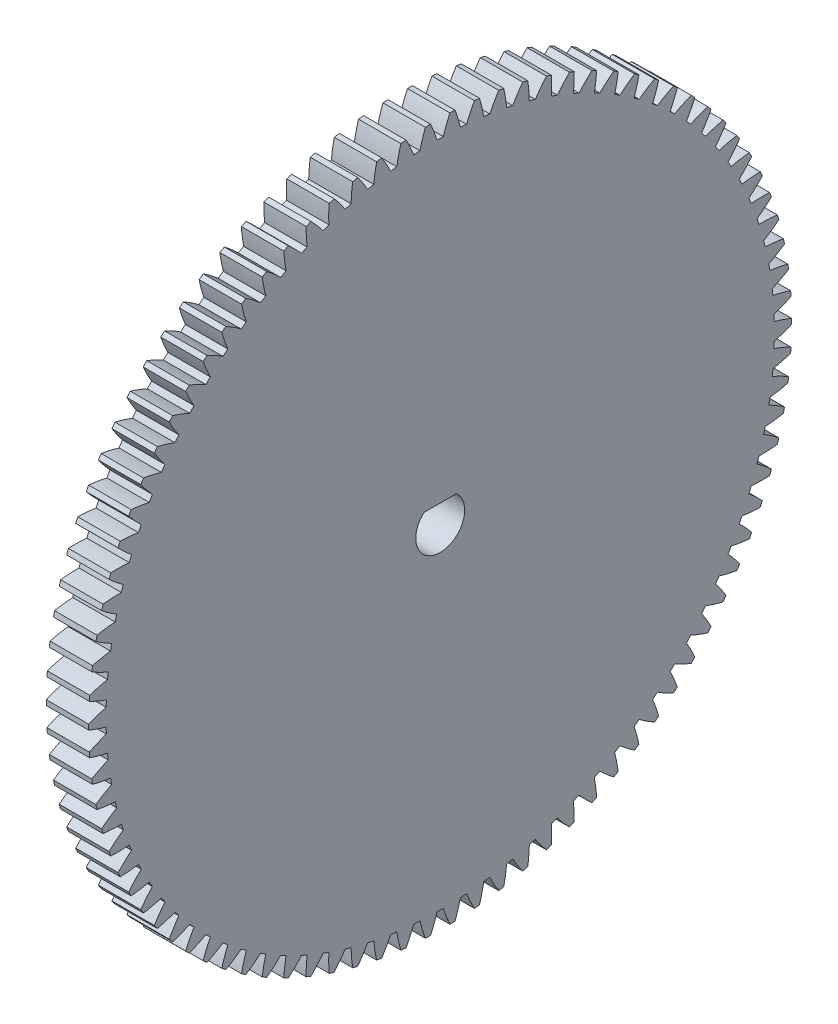
from build123d import *

# Parameters (mm, degrees)
BASPROSKE_W     = 4.4069
BASPROSKE_H     = 36.5125
TOOTHCUT_DEPTH  = 52.824184317
TEETHCUTS_COUNT = 90
TEETHCUTS_ANGLE = 356
BORE_DEPTH      = 50.8000508


with BuildPart() as part:
    # BasProSke → Base-Revolve (revolve)
    with BuildSketch(Plane(origin=(0, 0, 0), x_dir=(1, 0, 0), z_dir=(0, 1, 0))):
        with Locations((2.20345, 18.25625)):
            Rectangle(BASPROSKE_W, BASPROSKE_H)
    revolve(axis=Axis((-10, 0, 0), (1, 0, 0)))

    # TooCutSke → ToothCut (cut, through all)
    with BuildSketch(Plane(origin=(0, 0, 0), x_dir=(0, 0, -1), z_dir=(1, 0, 0))):
        with BuildLine():
            ThreePointArc((0.325148279, 34.713927281), (0, 34.71545), (-0.325148279, 34.713927281))
            ThreePointArc((-0.325148279, 34.713927281), (-0.64149097, 35.630588377), (-1.019284202, 36.523679937))
            ThreePointArc((-1.019284202, 36.523679937), (0, 36.5379), (1.019284202, 36.523679937))
            ThreePointArc((1.019284202, 36.523679937), (0.64149097, 35.630588377), (0.325148279, 34.713927281))
        make_face()
    toothcut = extrude(amount=TOOTHCUT_DEPTH, mode=Mode.SUBTRACT)

    # TeethCuts: ToothCut ×90 about axis
    teethcuts_axis = Axis((-10, 0, 0), (1, 0, 0))
    for i in range(1, TEETHCUTS_COUNT):
        add(toothcut.rotate(teethcuts_axis, i * TEETHCUTS_ANGLE / (TEETHCUTS_COUNT - 1)), mode=Mode.SUBTRACT)

    # BorSke → Bore (cut, symmetric)
    with BuildSketch(Plane(origin=(0, 0, 0), x_dir=(0, 0, -1), z_dir=(1, 0, 0))):
        with BuildLine():
            Line((-1.680052083, 1.905), (1.680052083, 1.905))
            ThreePointArc((1.680052083, 1.905), (0, -2.54), (-1.680052083, 1.905))
        make_face()
    extrude(amount=BORE_DEPTH, both=True, mode=Mode.SUBTRACT)


solid = part.part
